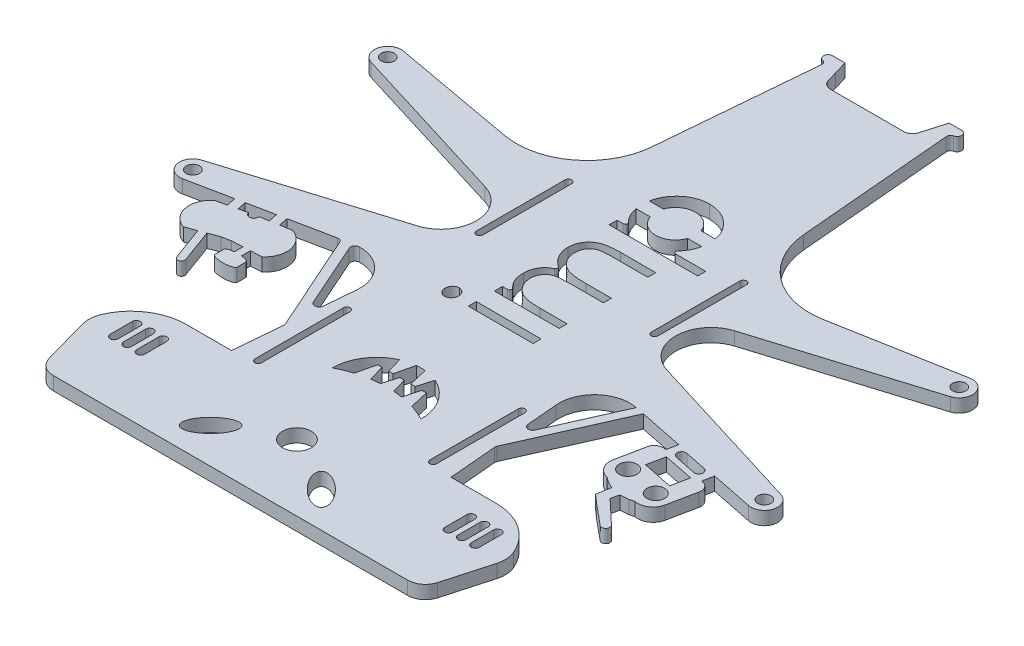
from build123d import *

# Parameters (mm, degrees)
SKETCH_1_R          = 1.5
SKETCH_1_R_2        = 25
SKETCH_1_R_3        = 1
SKETCH_1_R_4        = 2
EXTRUDE_1_DEPTH     = 3
CUT_EXTRUDE_1_DEPTH = 3
EXTRUDE_2_DEPTH     = 3
CUT_EXTRUDE_2_DEPTH = 3
SKETCH_6_R          = 3.25
EXTRUDE_3_DEPTH     = 3
EXTRUDE_4_DEPTH     = 3
SKETCH_8_W          = 14.615384615
SKETCH_8_H          = 1.794871795
CUT_EXTRUDE_3_DEPTH = 10
EXTRUDE_6_DEPTH     = 3
FILLET_2_R          = 2
FILLET_3_R          = 2
FILLET_4_R          = 1
FILLET_5_R          = 1
EXTRUDE_7_DEPTH     = 3
FILLET_6_R          = 1
FILLET_7_R          = 1
FILLET_11_R         = 1
FILLET_12_R         = 1
FILLET_13_R         = 1
FILLET_14_R         = 1
FILLET_22_R         = 0.5
FILLET_23_R         = 0.5
FILLET_24_R         = 0.5
FILLET_25_R         = 0.5
EXTRUDE_8_DEPTH     = 3
SKETCH_14_W         = 100
SKETCH_14_H         = 100
CUT_EXTRUDE_4_DEPTH = 10
SKETCH_15_R         = 3.25
EXTRUDE_9_DEPTH     = 3
SKETCH_16_R         = 3.25
SKETCH_16_RX        = 5
SKETCH_16_RY        = 2.25
CUT_EXTRUDE_5_DEPTH = 3


with BuildPart() as part:
    # 草图1 → 凸台-拉伸1 (new body)
    with BuildSketch(Plane(origin=(0, 0, 0), x_dir=(1, 0, 0), z_dir=(0, 1, 0))):
        with BuildLine():
            Line((-65.384333619, -19.133302588), (-28.141777015, -7.644526431))
            ThreePointArc((-28.141777015, -7.644526431), (-22.5, 0), (-28.141777015, 7.644526431))
            Line((-28.141777015, 7.644526431), (-65.384333619, 19.133302588))
            ThreePointArc((-65.384333619, 19.133302588), (-67.41435877, 22.711697239), (-63.963475544, 24.951633702))
            Line((-63.963475544, 24.951633702), (-35.956989403, 19.860837807))
            ThreePointArc((-35.956989403, 19.860837807), (-23.387681178, 22.884481961), (-17.156151846, 34.211351583))
            Line((-17.156151846, 34.211351583), (-14.077866308, 69.471713196))
            ThreePointArc((-14.077866308, 69.471713196), (-14.227947416, 70.111656421), (-14.777866308, 70.471713196))
            ThreePointArc((-14.777866308, 70.471713196), (-15.58285387, 71.562211952), (-14.577866308, 72.471713196))
            Line((-14.577866308, 72.471713196), (-11.764219385, 72.471713196))
            Line((-11.764219385, 72.471713196), (-10.884480237, 69.471713196))
            Line((-10.884480237, 69.471713196), (-10.181933712, 67.110709467))
            ThreePointArc((-10.181933712, 67.110709467), (-9.460655522, 66.077868179), (-8.265, 65.681117341))
            Line((-8.265, 65.681117341), (8.265, 65.681117341))
            ThreePointArc((8.265, 65.681117341), (9.462435388, 66.079197089), (10.183195998, 67.114968849))
            Line((10.183195998, 67.114968849), (10.878780421, 69.471713196))
            Line((10.878780421, 69.471713196), (11.764219385, 72.471713196))
            Line((11.764219385, 72.471713196), (14.577866308, 72.471713196))
            ThreePointArc((14.577866308, 72.471713196), (15.58285387, 71.562211952), (14.777866308, 70.471713196))
            ThreePointArc((14.777866308, 70.471713196), (14.227947416, 70.111656421), (14.077866308, 69.471713196))
            Line((14.077866308, 69.471713196), (17.156151846, 34.211351583))
            ThreePointArc((17.156151846, 34.211351583), (23.387681178, 22.884481961), (35.956989403, 19.860837807))
            Line((35.956989403, 19.860837807), (63.963475544, 24.951633702))
            ThreePointArc((63.963475544, 24.951633702), (67.41435877, 22.711697239), (65.384333619, 19.133302588))
            Line((65.384333619, 19.133302588), (28.141777015, 7.644526431))
            ThreePointArc((28.141777015, 7.644526431), (22.5, 0), (28.141777015, -7.644526431))
            Line((28.141777015, -7.644526431), (65.384333619, -19.133302588))
            ThreePointArc((65.384333619, -19.133302588), (67.406788203, -22.742012359), (63.902111383, -24.939817886))
            Line((63.902111383, -24.939817886), (56.552566669, -23.445096344))
            Line((56.552566669, -23.445096344), (54.298706289, -22.986715071))
            Line((54.298706289, -22.986715071), (53.800465775, -25.436563309))
            Line((53.800465775, -25.436563309), (54.094447564, -25.496352171))
            ThreePointArc((54.094447564, -25.496352171), (55.363545991, -26.352234716), (55.655733743, -27.854823172))
            Line((55.655733743, -27.854823172), (54.360308407, -34.224428592))
            ThreePointArc((54.360308407, -34.224428592), (52.862513952, -36.44535084), (50.232984154, -36.956679406))
            Line((50.232984154, -36.956679406), (49.153396756, -37.247352848))
            Line((49.153396756, -37.247352848), (47.289857921, -37.378589325))
            Line((47.289857921, -37.378589325), (46.865701298, -39.226418806))
            Line((46.865701298, -39.226418806), (47.842520442, -40.090507923))
            Line((47.842520442, -40.090507923), (52.204032724, -44.215700114))
            ThreePointArc((52.204032724, -44.215700114), (52.28182782, -45.486112615), (51.011415319, -45.563907712))
            Line((51.011415319, -45.563907712), (46.384876948, -41.738317209))
            Line((46.384876948, -41.738317209), (44.392211968, -39.975616168))
            Line((44.392211968, -39.975616168), (44.938003613, -36.900278432))
            Line((44.938003613, -36.900278432), (43.273760984, -36.051575614))
            Line((43.273760984, -36.051575614), (42.393469791, -35.362309761))
            ThreePointArc((42.393469791, -35.362309761), (40.172547544, -33.864515306), (39.661218978, -31.234985508))
            Line((39.661218978, -31.234985508), (40.956644314, -24.865380088))
            ThreePointArc((40.956644314, -24.865380088), (41.81252686, -23.596281661), (43.315115316, -23.304093909))
            Line((43.315115316, -23.304093909), (43.609097105, -23.363882771))
            Line((43.609097105, -23.363882771), (44.107337619, -20.914034532))
            Line((44.107337619, -20.914034532), (41.853477239, -20.455653259))
            Line((41.853477239, -20.455653259), (32.064056542, -18.464719321))
            ThreePointArc((32.064056542, -18.464719321), (25.142969185, -20.335475151), (22.5, -27))
            Line((22.5, -27), (28, -90))
            Line((28, -90), (28, -109.5))
            ThreePointArc((28, -109.5), (24.924621202, -116.924621202), (17.5, -120))
            Line((17.5, -120), (-17.5, -120))
            ThreePointArc((-17.5, -120), (-24.924621202, -116.924621202), (-28, -109.5))
            Line((-28, -109.5), (-28, -90))
            Line((-28, -90), (-22.5, -27))
            ThreePointArc((-22.5, -27), (-25.142969185, -20.335475151), (-32.064056542, -18.464719321))
            Line((-32.064056542, -18.464719321), (-41.853477239, -20.455653259))
            Line((-41.853477239, -20.455653259), (-44.303325478, -20.953893774))
            Line((-44.303325478, -20.953893774), (-43.880204303, -23.034380277))
            Line((-43.880204303, -23.034380277), (-41.415025587, -22.611519709))
            ThreePointArc((-41.415025587, -22.611519709), (-37.965652689, -26.400073845), (-39.661218978, -31.234985508))
            Line((-39.661218978, -31.234985508), (-42.155849958, -31.354795682))
            Line((-42.155849958, -31.354795682), (-42.155849958, -33.354795682))
            add(Edge.make_bspline(
                [(-40.455849958, -34.065358839), (-40.455849958, -33.527053417), (-42.155849958, -33.354795682)],
                knots=[3.141592654, 3.141592654, 3.141592654, 4.386659493, 4.386659493, 4.386659493], degree=2, weights=[1, 0.81240384, 1]))
            Line((-40.455849958, -34.065358839), (-40.455849958, -36.065358839))
            add(Edge.make_bspline(
                [(-45.455849958, -36.065358839), (-45.455849958, -36.815358839), (-42.955849958, -36.815358839), (-40.455849958, -36.815358839), (-40.455849958, -36.065358839)],
                knots=[3.141592654, 3.141592654, 3.141592654, 4.71238898, 4.71238898, 6.283185307, 6.283185307, 6.283185307], degree=2, weights=[1, 0.707106781, 1, 0.707106781, 1]))
            Line((-45.455849958, -36.065358839), (-45.455849958, -34.065358839))
            add(Edge.make_bspline(
                [(-43.755849958, -33.354795682), (-45.455849958, -33.527053417), (-45.455849958, -34.065358839)],
                knots=[5.038118468, 5.038118468, 5.038118468, 6.283185307, 6.283185307, 6.283185307], degree=2, weights=[1, 0.81240384, 1]))
            Line((-43.755849958, -33.354795682), (-43.755849958, -31.431639224))
            Line((-43.755849958, -31.431639224), (-46.230120603, -31.550471549))
            Line((-46.230120603, -31.550471549), (-48.189999193, -31.94906396))
            Line((-48.189999193, -31.94906396), (-50.524561924, -32.809957845))
            Line((-50.524561924, -32.809957845), (-47.756677611, -40.315876605))
            ThreePointArc((-47.756677611, -40.315876605), (-48.230481056, -41.343256912), (-49.257861364, -40.869453467))
            Line((-49.257861364, -40.869453467), (-52.025745676, -33.363534707))
            Line((-52.025745676, -33.363534707), (-54.360308407, -34.224428592))
            ThreePointArc((-54.360308407, -34.224428592), (-57.809681305, -30.435874456), (-56.114115016, -25.600962793))
            Line((-56.114115016, -25.600962793), (-53.679597255, -25.027342333))
            Line((-53.679597255, -25.027342333), (-54.10271843, -22.94685583))
            Line((-54.10271843, -22.94685583), (-56.552566669, -23.445096344))
            Line((-56.552566669, -23.445096344), (-63.902111383, -24.939817886))
            ThreePointArc((-63.902111383, -24.939817886), (-67.406788203, -22.742012359), (-65.384333619, -19.133302588))
        make_face()
        with Locations((-64.5, 22)):
            Circle(SKETCH_1_R, mode=Mode.SUBTRACT)
        with Locations((64.5, 22)):
            Circle(SKETCH_1_R, mode=Mode.SUBTRACT)
        with Locations((64.5, -22)):
            Circle(SKETCH_1_R, mode=Mode.SUBTRACT)
        with Locations((-64.5, -22)):
            Circle(SKETCH_1_R, mode=Mode.SUBTRACT)
        with Locations((0, -90)):
            Circle(SKETCH_1_R_2, mode=Mode.SUBTRACT)
        with Locations((-15, -65)):
            Circle(SKETCH_1_R_3, mode=Mode.SUBTRACT)
        with Locations((15, -65)):
            Circle(SKETCH_1_R_3, mode=Mode.SUBTRACT)
        with Locations((-15.42, -115)):
            Circle(SKETCH_1_R_3, mode=Mode.SUBTRACT)
        with Locations((17.43, -115)):
            Circle(SKETCH_1_R_3, mode=Mode.SUBTRACT)
        with Locations((43.190654614, -31.44255258)):
            Circle(SKETCH_1_R_4, mode=Mode.SUBTRACT)
        with Locations((51.030168976, -33.036922224)):
            Circle(SKETCH_1_R_4, mode=Mode.SUBTRACT)
        Polygon((45.075697701, -24.682625615), (51.935272768, -26.077699055), (51.138087945, -29.997456236), (44.278512878, -28.602382797), align=None, mode=Mode.SUBTRACT)
        with BuildLine():
            Line((-47.824490247, -23.710957187), (-45.852347275, -23.372668732))
            Line((-45.852347275, -23.372668732), (-46.263204068, -21.352486185))
            Line((-46.263204068, -21.352486185), (-52.14283984, -22.548263418))
            Line((-52.14283984, -22.548263418), (-51.731983047, -24.568445966))
            Line((-51.731983047, -24.568445966), (-49.784368838, -24.109549598))
            ThreePointArc((-49.784368838, -24.109549598), (-48.605133337, -24.890192687), (-47.824490247, -23.710957187))
        make_face(mode=Mode.SUBTRACT)
        with BuildLine():
            Line((46.703349664, -21.697119111), (51.603046141, -22.693600139))
            ThreePointArc((51.603046141, -22.693600139), (52.38368923, -23.87283564), (51.20445373, -24.65347873))
            Line((51.20445373, -24.65347873), (46.304757253, -23.656997702))
            ThreePointArc((46.304757253, -23.656997702), (45.524114164, -22.477762201), (46.703349664, -21.697119111))
        make_face(mode=Mode.SUBTRACT)
    extrude(amount=EXTRUDE_1_DEPTH)

    # 草图2 → 切除-拉伸1 (cut)
    with BuildSketch(Plane.XZ):
        with BuildLine():
            Line((-19, 2), (-19, -18))
            ThreePointArc((-19, -18), (-19.75, -18.75), (-20.5, -18))
            Line((-20.5, -18), (-20.5, 2))
            ThreePointArc((-20.5, 2), (-19.75, 2.75), (-19, 2))
        make_face()
        with BuildLine():
            Line((20.5, 2), (20.5, -18))
            ThreePointArc((20.5, -18), (19.75, -18.75), (19, -18))
            Line((19, -18), (19, 2))
            ThreePointArc((19, 2), (19.75, 2.75), (20.5, 2))
        make_face()
        with BuildLine():
            Line((-19, 52), (-19, 32))
            ThreePointArc((-19, 32), (-19.75, 31.25), (-20.5, 32))
            Line((-20.5, 32), (-20.5, 52))
            ThreePointArc((-20.5, 52), (-19.75, 52.75), (-19, 52))
        make_face()
        with BuildLine():
            Line((20.5, 52), (20.5, 32))
            ThreePointArc((20.5, 32), (19.75, 31.25), (19, 32))
            Line((19, 32), (19, 52))
            ThreePointArc((19, 52), (19.75, 52.75), (20.5, 52))
        make_face()
        with BuildLine():
            ThreePointArc((-10, 45), (0, 35), (10, 45))
            ThreePointArc((10, 45), (0, 42.595917942), (-10, 45))
        make_face()
    extrude(amount=-CUT_EXTRUDE_1_DEPTH, mode=Mode.SUBTRACT)

    # 草图3 → 凸台-拉伸2 (add)
    with BuildSketch(Plane.XZ):
        Polygon((-1.5, 42.647113875), (-0.5, 39.295917942), (0.5, 39.295917942), (1.5, 42.647113875), (1.5, 43.876111313), (3.5, 43.876111313), (3.5, 42.876111313), (4.5, 39.295917942), (5.5, 39.295917942), (6.5, 43.578068385), (6.5, 44.578068385), (-6.5, 44.578068385), (-6.5, 43.578068385), (-5.5, 39.295917942), (-4.5, 39.295917942), (-3.5, 42.876111313), (-3.5, 43.876111313), (-1.5, 43.876111313), align=None)
        Polygon((-2, 39.295917942), (-1, 35.050125629), (-1, 34.050125629), (1, 34.050125629), (1, 35.050125629), (2, 39.295917942), (3, 39.295917942), (4, 35.83484861), (4, 33.83484861), (-4, 33.83484861), (-4, 35.83484861), (-3, 39.295917942), align=None)
    extrude(amount=-EXTRUDE_2_DEPTH)

    # 草图4 → 切除-拉伸2 (cut)
    with BuildSketch(Plane.XZ):
        with BuildLine():
            Line((-28, 108), (-21.44761059, 108))
            ThreePointArc((-21.44761059, 108), (-26.31095871, 99.57775818), (-28, 90))
            Line((-28, 90), (-28, 108))
        make_face()
        with BuildLine():
            Line((-21.44761059, 114), (-21.44761059, 119.229664467))
            ThreePointArc((-21.44761059, 119.229664467), (-24.708218651, 117.134892526), (-26.986832981, 114))
            Line((-26.986832981, 114), (-21.44761059, 114))
        make_face()
        with BuildLine():
            Line((21.44761059, 119.229664467), (21.44761059, 114))
            Line((21.44761059, 114), (26.986832981, 114))
            ThreePointArc((26.986832981, 114), (24.708218651, 117.134892526), (21.44761059, 119.229664467))
        make_face()
        with BuildLine():
            Line((21.44761059, 108), (28, 108))
            Line((28, 108), (28, 90))
            ThreePointArc((28, 90), (26.31095871, 99.57775818), (21.44761059, 108))
        make_face()
    extrude(amount=-CUT_EXTRUDE_2_DEPTH, mode=Mode.SUBTRACT)

    # 草图6 → 凸台-拉伸3 (add)
    with BuildSketch(Plane.XZ):
        Polygon((-21.44761059, 119.229664467), (-21.44761059, 139), (-18.44761059, 142), (18.44761059, 142), (21.44761059, 139), (21.44761059, 119.229664467), align=None)
        with Locations((0, 131)):
            Circle(SKETCH_6_R, mode=Mode.SUBTRACT)
    extrude(amount=-EXTRUDE_3_DEPTH)

    # 草图7 → 凸台-拉伸4 (add)
    with BuildSketch(Plane.XZ):
        with BuildLine():
            Line((-26.611915935, 74.100127979), (-28, 90))
            ThreePointArc((-28, 90), (-26.31095871, 99.57775818), (-21.44761059, 108))
            Line((-21.44761059, 108), (-25.238858928, 108))
            ThreePointArc((-25.238858928, 108), (-30.974603213, 91.254573939), (-26.611915935, 74.100127979))
        make_face()
        with BuildLine():
            Line((28, 90), (26.611915935, 74.100127979))
            ThreePointArc((26.611915935, 74.100127979), (30.974603213, 91.254573939), (25.238858928, 108))
            Line((25.238858928, 108), (21.44761059, 108))
            ThreePointArc((21.44761059, 108), (26.31095871, 99.57775818), (28, 90))
        make_face()
    extrude(amount=-EXTRUDE_4_DEPTH)

    # 草图8 → 切除-拉伸3 (cut)
    # profile 1 of 4: a face of its own
    with BuildSketch(Plane(origin=(0, 3, 0), x_dir=(1, 0, 0), z_dir=(0, 1, 0))):
        with BuildLine():
            add(Edge.make_bspline(
                [(-12.886726023, -16.695259177), (-12.881559438, -16.583880229), (-12.871442272, -16.365778859), (-12.78480526, -16.050388758), (-12.637949914, -15.763205832), (-12.440923166, -15.508475929), (-12.209212061, -15.28989372), (-11.939149385, -15.136861089), (-11.647385735, -15.03850454), (-11.443870939, -15.026627081), (-11.340251664, -15.02057969)],
                knots=[0, 0, 0, 0, 1.055194115, 2.066272739, 3.074728998, 4.095836921, 5.109056067, 6.073838105, 7.019297344, 8, 8, 8, 8], degree=3))
            add(Edge.make_bspline(
                [(-11.340251664, -15.02057969), (-11.239322217, -15.02676346), (-11.039796646, -15.038988042), (-10.753091091, -15.136785118), (-10.4867809, -15.291197906), (-10.255519698, -15.508335766), (-10.05860187, -15.763242972), (-9.911717648, -16.050378891), (-9.825088291, -16.365781454), (-9.81497007, -16.583881107), (-9.809802946, -16.695259177)],
                knots=[0, 0, 0, 0, 0.96129708, 1.900370562, 2.859976407, 3.87933698, 4.906634145, 5.921202961, 6.938410037, 8, 8, 8, 8], degree=3))
            add(Edge.make_bspline(
                [(-9.809802946, -16.695259177), (-9.814772776, -16.805363606), (-9.8244459, -17.019667493), (-9.91341743, -17.330335163), (-10.058652133, -17.615069389), (-10.254230334, -17.870296089), (-10.488201175, -18.08304005), (-10.752928569, -18.237887624), (-11.039838024, -18.335458835), (-11.239336117, -18.347713855), (-11.340251664, -18.353913023)],
                knots=[0, 0, 0, 0, 1.054934014, 2.053291228, 3.073705704, 4.106921865, 5.123545215, 6.088680038, 7.033164197, 8, 8, 8, 8], degree=3))
            add(Edge.make_bspline(
                [(-11.340251664, -18.353913023), (-11.443856519, -18.347849671), (-11.647342991, -18.335940865), (-11.939314607, -18.237814487), (-12.207780332, -18.084329871), (-12.442211757, -17.870155222), (-12.637899956, -17.615106878), (-12.783105565, -17.330325477), (-12.872084647, -17.019670052), (-12.881756729, -16.805364475), (-12.886726023, -16.695259177)],
                knots=[0, 0, 0, 0, 0.98631895, 1.937192651, 2.907499808, 3.917963147, 4.944918757, 5.95915025, 6.951458133, 8, 8, 8, 8], degree=3))
        make_face()
    # profile 2 of 4: a face of its own
    with BuildSketch(Plane(origin=(0, 3, 0), x_dir=(1, 0, 0), z_dir=(0, 1, 0))):
        with Locations((0.574812438, -16.687246357)):
            Rectangle(SKETCH_8_W, SKETCH_8_H)
    # profile 3 of 4: a face of its own
    with BuildSketch(Plane(origin=(0, 3, 0), x_dir=(1, 0, 0), z_dir=(0, 1, 0))):
        with BuildLine():
            Line((-6.732879869, -11.687246356), (-6.732879869, -9.892374561))
            Line((-6.732879869, -9.892374561), (-4.192815766, -9.892374561))
            add(Edge.make_bspline(
                [(-4.192815766, -9.892374561), (-4.415030633, -9.73075199), (-4.840815622, -9.42106765), (-5.401902961, -8.913263921), (-5.878063845, -8.40597185), (-6.128023111, -8.04063824), (-6.248104228, -7.865130972)],
                knots=[0, 0, 0, 0, 1.134379233, 2.173579362, 3.122582517, 4, 4, 4, 4], degree=3))
            add(Edge.make_bspline(
                [(-6.248104228, -7.865130972), (-6.362420601, -7.625904331), (-6.589056106, -7.151630618), (-6.818962157, -6.400663618), (-6.96024845, -5.632236935), (-6.979570584, -5.113332856), (-6.989290125, -4.852310459)],
                knots=[0, 0, 0, 0, 1.014936303, 2.012140481, 3.000054389, 4, 4, 4, 4], degree=3))
            add(Edge.make_bspline(
                [(-6.989290125, -4.852310459), (-6.983316942, -4.675779143), (-6.971496333, -4.326433162), (-6.894583207, -3.808808427), (-6.761628501, -3.30676437), (-6.576462993, -2.823236405), (-6.352126323, -2.367759648), (-6.089230726, -1.949861169), (-5.793533674, -1.576493486), (-5.456545498, -1.241672677), (-5.059565631, -0.943243808), (-4.594980761, -0.670655267), (-4.056094738, -0.415435787), (-3.665357229, -0.274871892), (-3.459642689, -0.200868151)],
                knots=[0, 0, 0, 0, 1.009731074, 1.9982035, 2.985760524, 3.974587072, 4.955028184, 5.885388378, 6.793242796, 7.673688873, 8.594941726, 9.625945874, 10.750113716, 12, 12, 12, 12], degree=3))
            add(Edge.make_bspline(
                [(-3.459642689, -0.200868151), (-3.600923548, -0.122516711), (-3.878944436, 0.03166792), (-4.27244219, 0.290536806), (-4.640400754, 0.561856124), (-4.983582349, 0.847499422), (-5.299255188, 1.148666317), (-5.593859271, 1.460504363), (-5.859235293, 1.78999696), (-6.169749122, 2.245748162), (-6.500632643, 2.838098992), (-6.780285539, 3.587854704), (-6.958382103, 4.36481427), (-6.978919375, 4.89299314), (-6.989290125, 5.159708772)],
                knots=[0, 0, 0, 0, 0.861026002, 1.694378253, 2.508904292, 3.297437177, 4.073006284, 4.833627155, 5.583069468, 6.325614666, 7.772320565, 9.187282923, 10.579656144, 12, 12, 12, 12], degree=3))
            add(Edge.make_bspline(
                [(-6.989290125, 5.159708772), (-6.980164632, 5.404788282), (-6.962305154, 5.88443268), (-6.818747101, 6.58153261), (-6.581145391, 7.234432674), (-6.247003391, 7.836212796), (-5.829103217, 8.379880239), (-5.331294275, 8.854251838), (-4.755394713, 9.248897547), (-4.217951323, 9.512728994), (-3.742577496, 9.688365433), (-3.335696481, 9.798057508), (-2.887511184, 9.893090774), (-2.398382084, 9.973664652), (-1.867318843, 10.031915874), (-1.294077458, 10.07521915), (-0.678159801, 10.104487257), (-0.253214476, 10.106558002), (-0.03416192, 10.107625439)],
                knots=[0, 0, 0, 0, 1.209392158, 2.366897878, 3.497663982, 4.628180075, 5.751982922, 6.871462727, 8.009245026, 9.185977379, 9.818124946, 10.509294143, 11.264649411, 12.079922034, 12.956003306, 13.901808055, 14.918415426, 16, 16, 16, 16], degree=3))
            Line((-0.03416192, 10.107625439), (7.882504746, 10.107625439))
            Line((7.882504746, 10.107625439), (7.882504746, 8.312753644))
            Line((7.882504746, 8.312753644), (-0.042174741, 8.312753644))
            add(Edge.make_bspline(
                [(-0.042174741, 8.312753644), (-0.229149724, 8.312310759), (-0.588487207, 8.311459601), (-1.104211879, 8.296039014), (-1.574328733, 8.267131027), (-1.999451397, 8.232810379), (-2.379446458, 8.18641873), (-2.713249783, 8.125167289), (-3.002384394, 8.060792729), (-3.322786066, 7.953591969), (-3.675935078, 7.783806377), (-4.05401156, 7.520476321), (-4.385688848, 7.193677763), (-4.673633673, 6.814244855), (-4.907927573, 6.382604081), (-5.075206644, 5.906787646), (-5.178769402, 5.389855219), (-5.189089002, 5.032010004), (-5.19441833, 4.847208772)],
                knots=[0, 0, 0, 0, 1.253367865, 2.408782419, 3.458086102, 4.410454771, 5.267690823, 6.022776742, 6.685072793, 7.251272234, 8.28433411, 9.300106008, 10.325693114, 11.39283262, 12.482417211, 13.60372085, 14.762494729, 16, 16, 16, 16], degree=3))
            add(Edge.make_bspline(
                [(-5.19441833, 4.847208772), (-5.184068019, 4.620708193), (-5.163630118, 4.173456312), (-5.009972151, 3.516767389), (-4.754584283, 2.892432312), (-4.405299338, 2.304666254), (-3.976224641, 1.768959312), (-3.468477302, 1.306396199), (-2.893303661, 0.924572258), (-2.361072388, 0.665965365), (-1.882957865, 0.502586444), (-1.465252624, 0.394770801), (-0.989230441, 0.310399174), (-0.46047301, 0.232802746), (0.12552205, 0.180434383), (0.765136398, 0.134172682), (1.462748548, 0.112244239), (1.946331146, 0.10920396), (2.197408593, 0.107625439)],
                knots=[0, 0, 0, 0, 1.091136677, 2.154576964, 3.231646693, 4.331257757, 5.439166191, 6.528231045, 7.628049365, 8.756709726, 9.369482423, 10.061167346, 10.833871401, 11.698739631, 12.636505159, 13.668922441, 14.789697963, 16, 16, 16, 16], degree=3))
            Line((2.197408593, 0.107625439), (7.882504746, 0.107625439))
            Line((7.882504746, 0.107625439), (7.882504746, -1.687246356))
            Line((7.882504746, -1.687246356), (0.450613721, -1.687246356))
            add(Edge.make_bspline(
                [(0.450613721, -1.687246356), (0.240937614, -1.687700248), (-0.16245814, -1.68857349), (-0.740936293, -1.703866725), (-1.267113865, -1.732933159), (-1.740379465, -1.766536214), (-2.15987248, -1.814880338), (-2.527843423, -1.869792507), (-2.843364992, -1.934644008), (-3.189451952, -2.042005936), (-3.570645707, -2.206146569), (-3.977441102, -2.469847139), (-4.332843001, -2.800470104), (-4.640943771, -3.184031211), (-4.89270587, -3.618961385), (-5.06767862, -4.100450514), (-5.174429244, -4.620611486), (-5.187629646, -4.979989855), (-5.19441833, -5.164810459)],
                knots=[0, 0, 0, 0, 1.320285835, 2.540097241, 3.643286278, 4.638464947, 5.527188413, 6.301437306, 6.980978976, 7.552872752, 8.580906713, 9.583871393, 10.589652407, 11.624542289, 12.671761011, 13.738681301, 14.837052193, 16, 16, 16, 16], degree=3))
            add(Edge.make_bspline(
                [(-5.19441833, -5.164810459), (-5.185672816, -5.382045898), (-5.168243318, -5.814988414), (-5.011362174, -6.451000487), (-4.765622967, -7.065201212), (-4.424716062, -7.647811826), (-4.002411596, -8.183046003), (-3.505844038, -8.651837596), (-2.941640826, -9.044457068), (-2.417264272, -9.30755416), (-1.950985867, -9.476225367), (-1.552981602, -9.586811701), (-1.111878468, -9.683877879), (-0.626762447, -9.755215017), (-0.099798852, -9.824297584), (0.471716754, -9.85759811), (1.087270301, -9.890011579), (1.512256453, -9.89156758), (1.732665003, -9.892374561)],
                knots=[0, 0, 0, 0, 1.09880202, 2.189873405, 3.297736452, 4.440485332, 5.596193377, 6.739822772, 7.886349079, 9.066114917, 9.699498033, 10.395421758, 11.156987371, 11.985484089, 12.878178647, 13.847820956, 14.883825601, 16, 16, 16, 16], degree=3))
            Line((1.732665003, -9.892374561), (7.882504746, -9.892374561))
            Line((7.882504746, -9.892374561), (7.882504746, -11.687246356))
            Line((7.882504746, -11.687246356), (-6.732879869, -11.687246356))
        make_face()
    # profile 4 of 4: a face of its own
    with BuildSketch(Plane(origin=(0, 3, 0), x_dir=(1, 0, 0), z_dir=(0, 1, 0))):
        with BuildLine():
            Line((-6.732879869, 14.210189541), (-6.732879869, 16.005061336))
            Line((-6.732879869, 16.005061336), (-4.028552946, 16.005061336))
            add(Edge.make_bspline(
                [(-4.028552946, 16.005061336), (-4.272022893, 16.19622495), (-4.746659978, 16.568892466), (-5.3687579, 17.201483167), (-5.882796474, 17.881143639), (-6.297245926, 18.603587769), (-6.603313101, 19.373402332), (-6.831093731, 20.179582615), (-6.964916469, 21.031312129), (-6.981058078, 21.613566555), (-6.989290125, 21.910510054)],
                knots=[0, 0, 0, 0, 1.07939028, 2.104237756, 3.085658289, 4.045737152, 5.001099604, 5.968961907, 6.964192404, 8, 8, 8, 8], degree=3))
            add(Edge.make_bspline(
                [(-6.989290125, 21.910510054), (-6.981786246, 22.169890644), (-6.966954434, 22.682570005), (-6.866536979, 23.437217028), (-6.69443588, 24.163933505), (-6.446430649, 24.858608099), (-6.139827964, 25.528682758), (-5.752873475, 26.164237614), (-5.304838099, 26.775172217), (-4.789225808, 27.346121869), (-4.23135, 27.873672541), (-3.631222548, 28.329936433), (-3.008579197, 28.723490172), (-2.353767242, 29.041606152), (-1.671943071, 29.290796708), (-0.96035198, 29.468023438), (-0.221632321, 29.573495686), (0.28066894, 29.587646839), (0.534748336, 29.594804926)],
                knots=[0, 0, 0, 0, 1.041296284, 2.058176809, 3.050446431, 4.034000596, 5.01514041, 6.003636468, 7.015969324, 8.052561599, 9.08815499, 10.094063707, 11.074456064, 12.040834395, 13.011057502, 13.983766392, 14.980127149, 16, 16, 16, 16], degree=3))
            add(Edge.make_bspline(
                [(0.534748336, 29.594804926), (0.794190099, 29.587802151), (1.305846696, 29.573991669), (2.057201538, 29.466877349), (2.779986531, 29.295695212), (3.472999466, 29.049648451), (4.135763187, 28.731697089), (4.767799736, 28.344813887), (5.368906611, 27.888319789), (5.930923183, 27.366599059), (6.448633543, 26.800582282), (6.901422512, 26.195568056), (7.281658942, 25.560945624), (7.599275854, 24.899961812), (7.838659763, 24.206958164), (8.01133291, 23.485168005), (8.117815742, 22.734984311), (8.131827985, 22.224692014), (8.138915003, 21.966599798)],
                knots=[0, 0, 0, 0, 1.038740735, 2.04854663, 3.033179607, 4.009277356, 4.987731542, 5.972001279, 6.972200261, 8.005528982, 9.039189865, 10.040446548, 11.026516639, 11.997840187, 12.972163198, 13.956796175, 14.96660207, 16, 16, 16, 16], degree=3))
            add(Edge.make_bspline(
                [(8.138915003, 21.966599798), (8.130939352, 21.676266168), (8.115191082, 21.102989758), (7.975414996, 20.262416046), (7.745849946, 19.457090953), (7.423906536, 18.689380643), (7.010425099, 17.957146838), (6.507102104, 17.263276881), (5.914024841, 16.604335707), (5.464135026, 16.207712609), (5.234267567, 16.005061336)],
                knots=[0, 0, 0, 0, 1.014661154, 2.003492687, 2.970165371, 3.937187664, 4.907406957, 5.904113462, 6.929124205, 8, 8, 8, 8], degree=3))
            Line((5.234267567, 16.005061336), (13.267120131, 16.005061336))
            Line((13.267120131, 16.005061336), (13.267120131, 14.210189541))
            Line((13.267120131, 14.210189541), (-6.732879869, 14.210189541))
        make_face()
        with BuildLine():
            add(Edge.make_bspline(
                [(-5.19441833, 21.894484413), (-5.190759712, 21.691172627), (-5.183556836, 21.290904126), (-5.097991414, 20.704205732), (-4.97377575, 20.139089002), (-4.785707749, 19.601249279), (-4.554857388, 19.085531471), (-4.266388752, 18.595907672), (-3.925520147, 18.132721572), (-3.538781039, 17.697138541), (-3.112639964, 17.303634007), (-2.657852484, 16.955274419), (-2.174994543, 16.662661247), (-1.6685639, 16.419792559), (-1.134590842, 16.234973801), (-0.576116484, 16.10379826), (0.007470444, 16.021339101), (0.404933339, 16.010545173), (0.606863721, 16.005061336)],
                knots=[0, 0, 0, 0, 1.05670511, 2.080379991, 3.077984906, 4.06214886, 5.038337365, 6.01289324, 7.01187578, 8.025460281, 9.038092164, 10.024533457, 11.000252242, 11.969694649, 12.940728589, 13.933144304, 14.949937299, 16, 16, 16, 16], degree=3))
            add(Edge.make_bspline(
                [(0.606863721, 16.005061336), (0.87192853, 16.014190158), (1.391212939, 16.032074295), (2.148872706, 16.176080314), (2.865208705, 16.413076216), (3.535559219, 16.748148977), (4.155767846, 17.166701253), (4.704658074, 17.680148628), (5.189420062, 18.269400467), (5.597727714, 18.932806129), (5.927597083, 19.644641021), (6.171214832, 20.384658036), (6.315812821, 21.147664084), (6.334582123, 21.662842251), (6.344043208, 21.922529285)],
                knots=[0, 0, 0, 0, 1.037533453, 2.032615907, 3.008487753, 3.983910949, 4.958815134, 5.928528047, 6.917017829, 7.938835504, 8.970843303, 9.983125212, 10.983349323, 12, 12, 12, 12], degree=3))
            add(Edge.make_bspline(
                [(6.344043208, 21.922529285), (6.335149367, 22.177019089), (6.317496692, 22.682135601), (6.164710861, 23.425900686), (5.931296129, 24.148687531), (5.591011306, 24.835495278), (5.173717406, 25.479961594), (4.673487556, 26.063791665), (4.089732375, 26.569571195), (3.44405306, 27.004781884), (2.752316298, 27.352715187), (2.037893906, 27.617009764), (1.300914811, 27.767580523), (0.803817242, 27.78913482), (0.554780388, 27.799933131)],
                knots=[0, 0, 0, 0, 1.001123591, 1.987050352, 2.978152323, 3.984730168, 4.995502505, 5.994801396, 7.000994558, 8.027767845, 9.053126238, 10.042874082, 11.019515457, 12, 12, 12, 12], degree=3))
            add(Edge.make_bspline(
                [(0.554780388, 27.799933131), (0.30418472, 27.791614723), (-0.195054223, 27.775042715), (-0.930905951, 27.612000989), (-1.65001883, 27.366531832), (-2.332956693, 27.01081947), (-2.973838915, 26.582346034), (-3.547071041, 26.075593605), (-4.039482972, 25.494610462), (-4.457107695, 24.855146062), (-4.783130163, 24.162245514), (-5.022899387, 23.435038549), (-5.16663385, 22.674707736), (-5.185075369, 22.15684657), (-5.19441833, 21.894484413)],
                knots=[0, 0, 0, 0, 0.984010603, 1.960354772, 2.950163297, 3.964735994, 4.97843856, 5.975353722, 6.962442164, 7.964544167, 8.969901786, 9.964615439, 10.968820376, 12, 12, 12, 12], degree=3))
        make_face(mode=Mode.SUBTRACT)
    extrude(amount=-CUT_EXTRUDE_3_DEPTH, mode=Mode.SUBTRACT)


with BuildPart() as cut_extrude_3_kept_piece:
    # of the separate pieces the step leaves, the one the design keeps (cut_extrude_3_pieces_kept)
    add(part.part.solids().sort_by_distance((44.938003613, 0, 36.900278432))[0])

    # 草图10 → 凸台-拉伸6 (add)
    with BuildSketch(Plane.XZ):
        with BuildLine():
            Line((-26.986832981, 114), (-31.486832981, 114))
            ThreePointArc((-31.486832981, 114), (-32.986832981, 111), (-31.486832981, 108))
            Line((-31.486832981, 108), (-26.986832981, 108))
            Line((-26.986832981, 108), (-26.986832981, 114))
        make_face()
        with BuildLine():
            Line((26.986832981, 108), (26.986832981, 114))
            Line((26.986832981, 114), (31.486832981, 114))
            ThreePointArc((31.486832981, 114), (32.986832981, 111), (31.486832981, 108))
            Line((31.486832981, 108), (26.986832981, 108))
        make_face()
    extrude(amount=-EXTRUDE_6_DEPTH)

    # 圆角2
    fillet_2_edges = [cut_extrude_3_kept_piece.edges().sort_by_distance(p)[0] for p in [
        (-21.44761059, 1.5, 114),
    ]]
    fillet(fillet_2_edges, radius=FILLET_2_R)

    # 圆角3
    fillet_3_edges = [cut_extrude_3_kept_piece.edges().sort_by_distance(p)[0] for p in [
        (21.44761059, 1.5, 114),
    ]]
    fillet(fillet_3_edges, radius=FILLET_3_R)

    # 圆角4
    fillet_4_edges = [cut_extrude_3_kept_piece.edges().sort_by_distance(p)[0] for p in [
        (-25.238858928, 1.5, 108),
    ]]
    fillet(fillet_4_edges, radius=FILLET_4_R)

    # 圆角5
    fillet_5_edges = [cut_extrude_3_kept_piece.edges().sort_by_distance(p)[0] for p in [
        (25.238858928, 1.5, 108),
    ]]
    fillet(fillet_5_edges, radius=FILLET_5_R)

    # 草图11 → 凸台-拉伸7 (add)
    with BuildSketch(Plane.XZ):
        Polygon((-32.064056542, 18.464719321), (-23.444919114, 37.823618943), (-23.803822596, 41.934695195), (-34.071552615, 18.872995989), align=None)
        Polygon((34.071552615, 18.872995989), (32.064056542, 18.464719321), (23.444919114, 37.823618943), (23.803822596, 41.934695195), align=None)
    extrude(amount=-EXTRUDE_7_DEPTH)

    # 圆角6
    fillet_6_edges = [cut_extrude_3_kept_piece.edges().sort_by_distance(p)[0] for p in [
        (23.803822596, 1.5, 41.934695195),
    ]]
    fillet(fillet_6_edges, radius=FILLET_6_R)

    # 圆角7
    fillet_7_edges = [cut_extrude_3_kept_piece.edges().sort_by_distance(p)[0] for p in [
        (23.444919114, 1.5, 37.823618943),
    ]]
    fillet(fillet_7_edges, radius=FILLET_7_R)

    # 圆角11
    fillet_11_edges = [cut_extrude_3_kept_piece.edges().sort_by_distance(p)[0] for p in [
        (-23.803822596, 1.5, 41.934695195),
    ]]
    fillet(fillet_11_edges, radius=FILLET_11_R)

    # 圆角12
    fillet_12_edges = [cut_extrude_3_kept_piece.edges().sort_by_distance(p)[0] for p in [
        (-34.071552615, 1.5, 18.872995989),
    ]]
    fillet(fillet_12_edges, radius=FILLET_12_R)

    # 圆角13
    fillet_13_edges = [cut_extrude_3_kept_piece.edges().sort_by_distance(p)[0] for p in [
        (-23.444919114, 1.5, 37.823618943),
    ]]
    fillet(fillet_13_edges, radius=FILLET_13_R)

    # 圆角14
    fillet_14_edges = [cut_extrude_3_kept_piece.edges().sort_by_distance(p)[0] for p in [
        (-32.064056542, 1.5, 18.464719321),
    ]]
    fillet(fillet_14_edges, radius=FILLET_14_R)

    # 圆角22
    fillet_22_edges = [cut_extrude_3_kept_piece.edges().sort_by_distance(p)[0] for p in [
        (-4.192815766, 1.5, 9.892374561),
    ]]
    fillet(fillet_22_edges, radius=FILLET_22_R)

    # 圆角23
    fillet_23_edges = [cut_extrude_3_kept_piece.edges().sort_by_distance(p)[0] for p in [
        (-3.459642689, 1.5, 0.200868151),
    ]]
    fillet(fillet_23_edges, radius=FILLET_23_R)

    # 圆角24
    fillet_24_edges = [cut_extrude_3_kept_piece.edges().sort_by_distance(p)[0] for p in [
        (-4.028552946, 1.5, -16.005061336),
    ]]
    fillet(fillet_24_edges, radius=FILLET_24_R)

    # 圆角25
    fillet_25_edges = [cut_extrude_3_kept_piece.edges().sort_by_distance(p)[0] for p in [
        (5.234267567, 1.5, -16.005061336),
    ]]
    fillet(fillet_25_edges, radius=FILLET_25_R)

    # 草图13 → 凸台-拉伸8 (add)
    with BuildSketch(Plane.XZ):
        with BuildLine():
            Line((4.803350562, -20.410510054), (9.803350562, -20.410510054))
            Line((9.803350562, -20.410510054), (9.803350562, -23.410510054))
            Line((9.803350562, -23.410510054), (4.803350562, -23.410510054))
            ThreePointArc((4.803350562, -23.410510054), (0.560709875, -26.410510054), (-3.681930812, -23.410510054))
            Line((-3.681930812, -23.410510054), (-8.681930812, -23.410510054))
            Line((-8.681930812, -23.410510054), (-8.681930812, -20.410510054))
            Line((-8.681930812, -20.410510054), (-3.681930812, -20.410510054))
            ThreePointArc((-3.681930812, -20.410510054), (0.560709875, -17.410510054), (4.803350562, -20.410510054))
        make_face()
    extrude(amount=-EXTRUDE_8_DEPTH)

    # 草图14 → 切除-拉伸4 (cut)
    with BuildSketch(Plane.XZ):
        with Locations((0, 113)):
            Rectangle(SKETCH_14_W, SKETCH_14_H)
    extrude(amount=-CUT_EXTRUDE_4_DEPTH, mode=Mode.SUBTRACT)

    # 草图15 → 凸台-拉伸9 (add)
    with BuildSketch(Plane.XZ):
        with BuildLine():
            Line((-40, 78), (40, 78))
            ThreePointArc((40, 78), (42.417656629, 77.186681099), (43.852150341, 75.077468213))
            Line((43.852150341, 75.077468213), (46.778225512, 64.616202319))
            ThreePointArc((46.778225512, 64.616202319), (46.988830329, 62.634061082), (46.538461538, 60.692307692))
            ThreePointArc((46.538461538, 60.692307692), (41.933752453, 55.099371321), (35, 53))
            Line((35, 53), (-35, 53))
            ThreePointArc((-35, 53), (-41.933752453, 55.099371321), (-46.538461538, 60.692307692))
            ThreePointArc((-46.538461538, 60.692307692), (-46.988830329, 62.634061082), (-46.778225512, 64.616202319))
            Line((-46.778225512, 64.616202319), (-43.852150341, 75.077468213))
            ThreePointArc((-43.852150341, 75.077468213), (-42.417656629, 77.186681099), (-40, 78))
        make_face()
        with Locations((0, 63)):
            Circle(SKETCH_15_R, mode=Mode.SUBTRACT)
    extrude(amount=-EXTRUDE_9_DEPTH)

    # 草图16 → 切除-拉伸5 (cut)
    with BuildSketch(Plane.XZ):
        with Locations((0, 63)):
            Circle(SKETCH_16_R)
        with Locations(Location((-12.5, 70), (0, 0, -45))):
            Ellipse(SKETCH_16_RX, SKETCH_16_RY)
        with Locations(Location((12.5, 70), (0, 0, -135))):
            Ellipse(SKETCH_16_RX, SKETCH_16_RY)
        with BuildLine():
            Line((-39.86190379, 63.5), (-39.86190379, 58.5))
            ThreePointArc((-39.86190379, 58.5), (-40.76190379, 57.6), (-41.66190379, 58.5))
            Line((-41.66190379, 58.5), (-41.66190379, 63.5))
            ThreePointArc((-41.66190379, 63.5), (-40.76190379, 64.4), (-39.86190379, 63.5))
        make_face()
        with BuildLine():
            Line((-36.86190379, 63.5), (-36.86190379, 58.5))
            ThreePointArc((-36.86190379, 58.5), (-37.76190379, 57.6), (-38.66190379, 58.5))
            Line((-38.66190379, 58.5), (-38.66190379, 63.5))
            ThreePointArc((-38.66190379, 63.5), (-37.76190379, 64.4), (-36.86190379, 63.5))
        make_face()
        with BuildLine():
            Line((-33.86190379, 63.5), (-33.86190379, 58.5))
            ThreePointArc((-33.86190379, 58.5), (-34.76190379, 57.6), (-35.66190379, 58.5))
            Line((-35.66190379, 58.5), (-35.66190379, 63.5))
            ThreePointArc((-35.66190379, 63.5), (-34.76190379, 64.4), (-33.86190379, 63.5))
        make_face()
        with BuildLine():
            Line((33.86190379, 63.5), (33.86190379, 58.5))
            ThreePointArc((33.86190379, 58.5), (34.76190379, 57.6), (35.66190379, 58.5))
            Line((35.66190379, 58.5), (35.66190379, 63.5))
            ThreePointArc((35.66190379, 63.5), (34.76190379, 64.4), (33.86190379, 63.5))
        make_face()
        with BuildLine():
            Line((36.86190379, 63.5), (36.86190379, 58.5))
            ThreePointArc((36.86190379, 58.5), (37.76190379, 57.6), (38.66190379, 58.5))
            Line((38.66190379, 58.5), (38.66190379, 63.5))
            ThreePointArc((38.66190379, 63.5), (37.76190379, 64.4), (36.86190379, 63.5))
        make_face()
        with BuildLine():
            Line((39.86190379, 63.5), (39.86190379, 58.5))
            ThreePointArc((39.86190379, 58.5), (40.76190379, 57.6), (41.66190379, 58.5))
            Line((41.66190379, 58.5), (41.66190379, 63.5))
            ThreePointArc((41.66190379, 63.5), (40.76190379, 64.4), (39.86190379, 63.5))
        make_face()
    extrude(amount=-CUT_EXTRUDE_5_DEPTH, mode=Mode.SUBTRACT)


solid = cut_extrude_3_kept_piece.part
